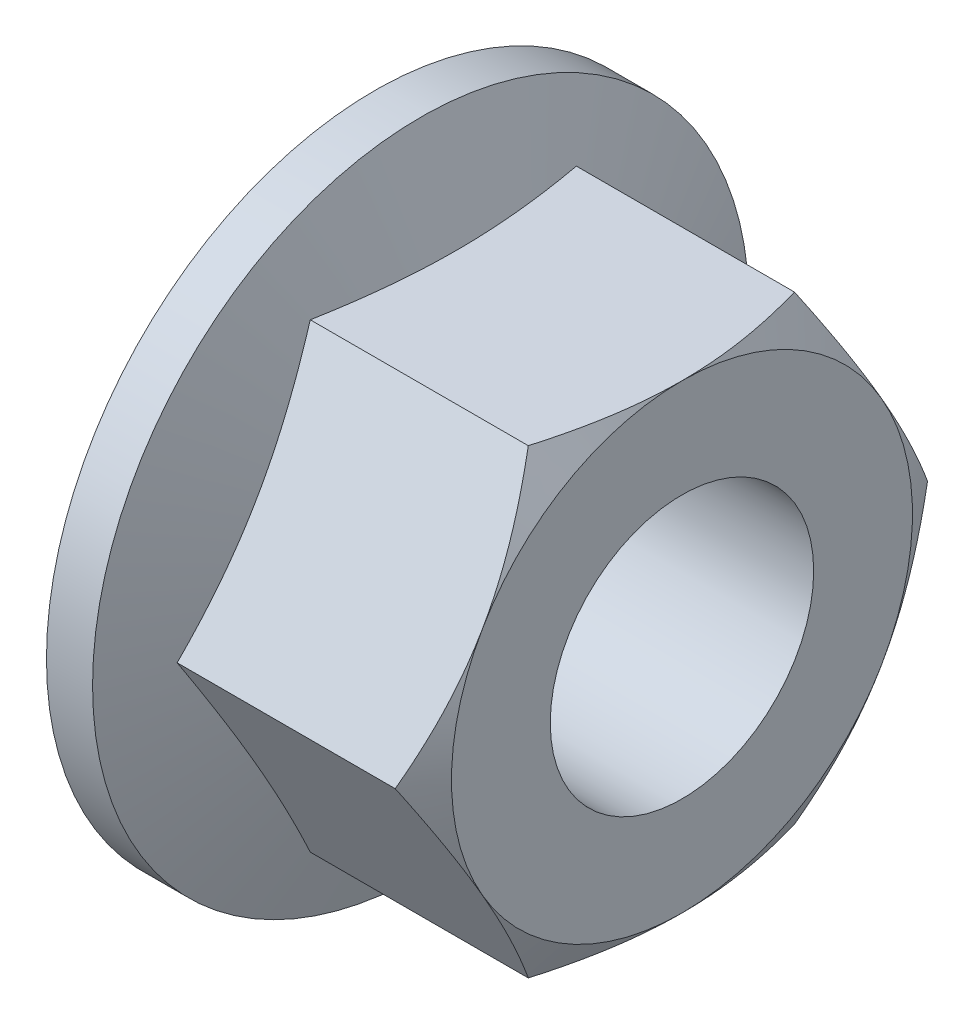
from build123d import *

# Parameters (mm, degrees)
SKETCH1_R      = 6
EXTRUDE1_DEPTH = 14


# Read off the part's stored shape, not the designer's step: Cut-Extrude1
with BuildPart() as part:
    # Sketch1 → Extrude1 (new body)
    with BuildSketch(Plane(origin=(0, 0, 0), x_dir=(0, 0, -1), z_dir=(1, 0, 0))):
        Polygon((12.124355653, 0), (6.062177826, 10.5), (-6.062177826, 10.5), (-12.124355653, 0), (-6.062177826, -10.5), (6.062177826, -10.5), align=None)
        Circle(SKETCH1_R, mode=Mode.SUBTRACT)
    extrude(amount=EXTRUDE1_DEPTH)

    # Cut-Extrude1 outline → Cut-Extrude1 (revolve, cut)
    with BuildSketch(Plane.YX):
        Polygon((12.124355657, 14.000000022), (10.499999982, 14.000000022), (12.124355657, 13.062177824), align=None)
    revolve(axis=Axis((0, 0, 0), (1, 0, 0)), mode=Mode.SUBTRACT)

    # Sketch3 → Revolve1 (revolve)
    with BuildSketch(Plane.XY, mode=Mode.PRIVATE) as revolve1_sk:
        Polygon((0, 6), (0, 14.95), (2.1, 14.95), (5.357533597, 6), align=None)
    revolve(revolve1_sk.sketch.rotate(Axis((0, 0, 0), (1, 0, 0)), 90), axis=Axis((0, 0, 0), (1, 0, 0)))


solid = part.part
